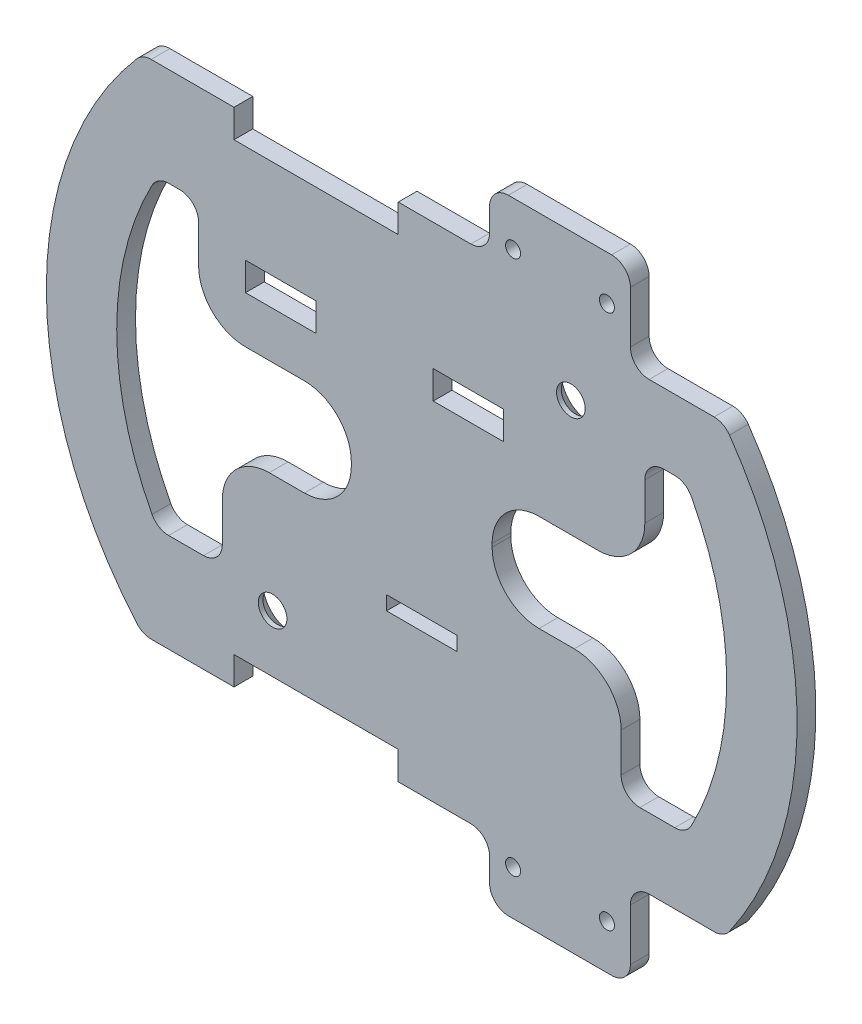
from build123d import *

# Parameters (mm, degrees)
ESBO_O1_R                = 3.05
ESBO_O1_W                = 15
ESBO_O1_H                = 3
ESBO_O1_R_2              = 1.6
ESBO_O1_H_2              = 6
RESSALTO_EXTRUS_O1_DEPTH = 4
CHANFRO1_SIZE            = 3
FILETE1_R                = 4
FILETE2_R                = 10
FILETE3_R                = 10


with BuildPart() as part:
    # Esboço1 → Ressalto-extrusão1 (new body)
    with BuildSketch(Plane.XY):
        with BuildLine():
            Line((14.471901241, -53.5), (14.471901241, -66.5))
            Line((14.471901241, -66.5), (44.471901241, -66.5))
            Line((44.471901241, -66.5), (44.471901241, -47.5))
            Line((44.471901241, -47.5), (64.371965948, -47.5))
            ThreePointArc((64.371965948, -47.5), (80, 0), (64.371965948, 47.5))
            Line((64.371965948, 47.5), (44.471901241, 47.5))
            Line((44.471901241, 47.5), (44.471901241, 66.5))
            Line((44.471901241, 66.5), (14.471901241, 66.5))
            Line((14.471901241, 66.5), (14.471901241, 53.5))
            Line((14.471901241, 53.5), (-5.003543323, 53.5))
            Line((-5.003543323, 53.5), (-5.003543323, 47.5))
            Line((-5.003543323, 47.5), (-40.003543323, 47.5))
            Line((-40.003543323, 47.5), (-40.003543323, 53.5))
            Line((-40.003543323, 53.5), (-59.478987886, 53.5))
            ThreePointArc((-59.478987886, 53.5), (-80, 0), (-59.478987886, -53.5))
            Line((-59.478987886, -53.5), (-40.003543323, -53.5))
            Line((-40.003543323, -53.5), (-40.003543323, -47.5))
            Line((-40.003543323, -47.5), (-5.003543323, -47.5))
            Line((-5.003543323, -47.5), (-5.003543323, -53.5))
            Line((-5.003543323, -53.5), (14.471901241, -53.5))
        make_face()
        with BuildLine():
            Line((-42.5, -32.5), (-56.291651246, -32.5))
            ThreePointArc((-56.291651246, -32.5), (-65, 0), (-56.291651246, 32.5))
            Line((-56.291651246, 32.5), (-47.55, 32.5))
            Line((-47.55, 32.5), (-47.55, 10.5))
            Line((-47.55, 10.5), (-15, 10.5))
            Line((-15, 10.5), (-15, -10.2))
            Line((-15, -10.2), (-42.5, -10.2))
            Line((-42.5, -10.2), (-42.5, -32.5))
        make_face(mode=Mode.SUBTRACT)
        with BuildLine():
            Line((47.55, 32.5), (56.291651246, 32.5))
            ThreePointArc((56.291651246, 32.5), (65, 0), (56.291651246, -32.5))
            Line((56.291651246, -32.5), (42.5, -32.5))
            Line((42.5, -32.5), (42.5, -10.2))
            Line((42.5, -10.2), (15, -10.2))
            Line((15, -10.2), (15, 10.5))
            Line((15, 10.5), (47.55, 10.5))
            Line((47.55, 10.5), (47.55, 32.5))
        make_face(mode=Mode.SUBTRACT)
        with Locations((-31.783703802, -35.29937921)):
            Circle(ESBO_O1_R, mode=Mode.SUBTRACT)
        with Locations((0, -21.7)):
            Rectangle(ESBO_O1_W, ESBO_O1_H, mode=Mode.SUBTRACT)
        with Locations((19.471901241, -57)):
            Circle(ESBO_O1_R_2, mode=Mode.SUBTRACT)
        with Locations((39.471901241, -57)):
            Circle(ESBO_O1_R_2, mode=Mode.SUBTRACT)
        with Locations((-30.05, 23.5)):
            Rectangle(ESBO_O1_W, ESBO_O1_H_2, mode=Mode.SUBTRACT)
        with Locations((9.95, 23.5)):
            Rectangle(ESBO_O1_W, ESBO_O1_H_2, mode=Mode.SUBTRACT)
        with Locations((31.783703802, 35.29937921)):
            Circle(ESBO_O1_R, mode=Mode.SUBTRACT)
        with Locations((19.471901241, 57)):
            Circle(ESBO_O1_R_2, mode=Mode.SUBTRACT)
        with Locations((39.471901241, 57)):
            Circle(ESBO_O1_R_2, mode=Mode.SUBTRACT)
    extrude(amount=RESSALTO_EXTRUS_O1_DEPTH)

    # Chanfro1
    chanfro1_edges = [part.edges().sort_by_distance(p)[0] for p in [
        (28.733703802, 35.29937921, 0),
        (-34.833703802, -35.29937921, 0),
    ]]
    chamfer(chanfro1_edges, length=CHANFRO1_SIZE)

    # Filete1
    filete1_edges = [part.edges().sort_by_distance(p)[0] for p in [
        (56.291651246, 32.5, 2),
        (47.55, 32.5, 2),
        (42.5, -32.5, 2),
        (56.291651246, -32.5, 2),
        (-42.5, -32.5, 2),
        (-56.291651246, -32.5, 2),
        (-47.55, 32.5, 2),
        (-56.291651246, 32.5, 2),
        (14.471901241, -53.5, 2),
        (14.471901241, 53.5, 2),
        (44.471901241, 47.5, 2),
        (44.471901241, -47.5, 2),
        (14.471901241, 66.5, 2),
        (44.471901241, 66.5, 2),
        (44.471901241, -66.5, 2),
        (14.471901241, -66.5, 2),
        (-59.478987886, 53.5, 2),
        (64.371965948, 47.5, 2),
        (64.371965948, -47.5, 2),
        (-59.478987886, -53.5, 2),
    ]]
    fillet(filete1_edges, radius=FILETE1_R)

    # Filete2
    filete2_edges = [part.edges().sort_by_distance(p)[0] for p in [
        (15, -10.2, 2),
        (-15, -10.2, 2),
        (-15, 10.5, 2),
        (15, 10.5, 2),
    ]]
    fillet(filete2_edges, radius=FILETE2_R)

    # Filete3
    filete3_edges = [part.edges().sort_by_distance(p)[0] for p in [
        (47.55, 10.5, 2),
        (-47.55, 10.5, 2),
        (42.5, -10.2, 2),
        (-42.5, -10.2, 2),
    ]]
    fillet(filete3_edges, radius=FILETE3_R)


solid = part.part
